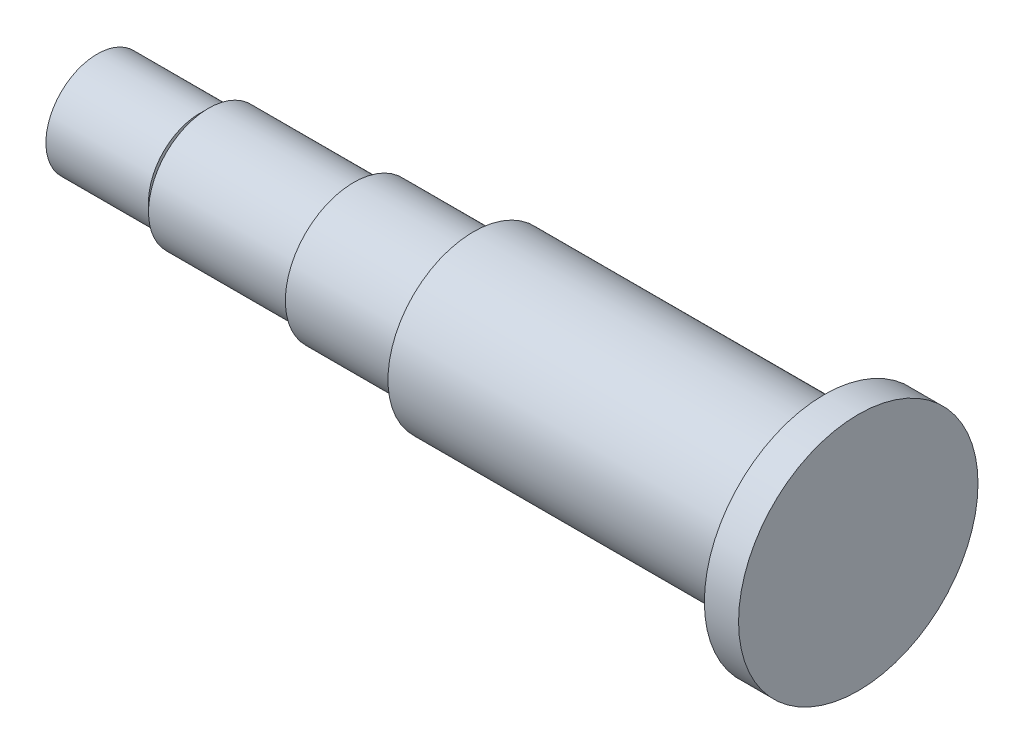
from build123d import *

# Parameters (mm, degrees)
SKETCH_2_W          = 4.549870692
SKETCH_2_H          = 5
CUT_EXTRUDE_1_DEPTH = 12
FILLET_1_R          = 2.5
FILLET_2_R          = 2.5


with BuildPart() as part:
    # 草图1 → 旋转1 (revolve)
    with BuildSketch(Plane.XY, mode=Mode.PRIVATE) as revolve_1_sk:
        Polygon((0, 0), (0, 6), (12, 6), (12, 5), (13, 5), (13, 7), (30, 7), (30, 8), (44, 8), (44, 10), (84, 10), (84, 9), (85, 9), (85, 14), (89, 14), (89, 0), align=None)
    revolve(revolve_1_sk.sketch.rotate(Axis((0, 0, 0), (-1, 0, 0)), 90), axis=Axis((0, 0, 0), (-1, 0, 0)))

    # 草图2 → 切除-拉伸1 (cut)
    with BuildSketch(Plane.ZY.offset(-28)):
        with Locations((-5.274935346, 0)):
            Rectangle(SKETCH_2_W, SKETCH_2_H)
    extrude(amount=CUT_EXTRUDE_1_DEPTH, mode=Mode.SUBTRACT)

    # 圆角1
    fillet_1_edges = [part.edges().sort_by_distance(p)[0] for p in [
        (16, -2.5, -4.769174208),
        (16, 2.5, -4.769174208),
    ]]
    fillet(fillet_1_edges, radius=FILLET_1_R - 0.0001)  # a hair under: the kernel refuses the full size

    # 圆角2
    fillet_2_edges = [part.edges().sort_by_distance(p)[0] for p in [
        (28, 2.5, -4.769174208),
        (28, -2.5, -4.769174208),
    ]]
    fillet(fillet_2_edges, radius=FILLET_2_R - 0.0001)  # a hair under: the kernel refuses the full size


solid = part.part
